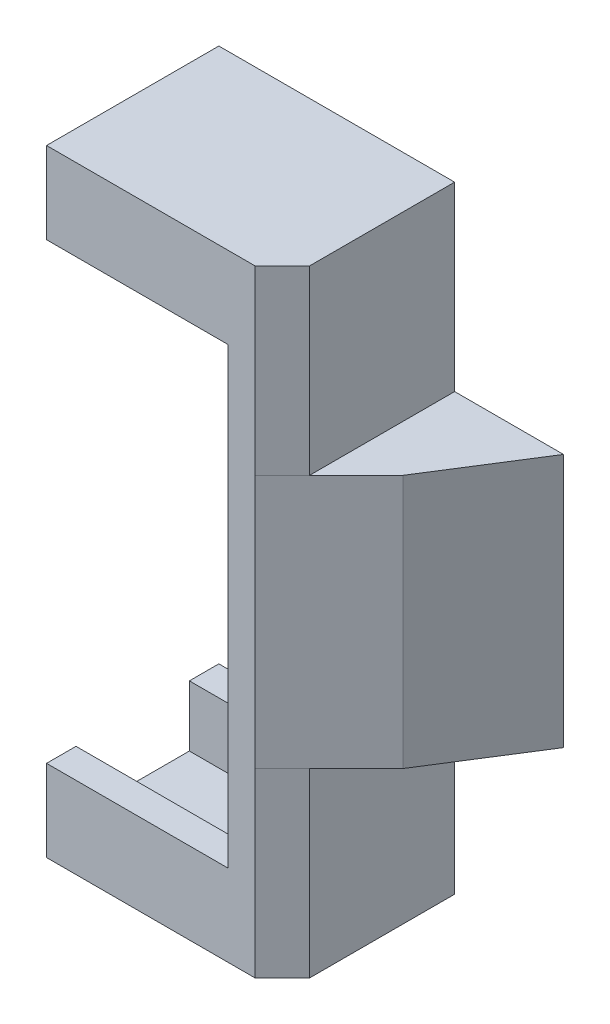
from build123d import *

# Parameters (mm, degrees)
BOSS_EXTRUDE1_DEPTH = 34
SKETCH2_W           = 6.25
SKETCH2_H           = 31.7
CUT_EXTRUDE1_DEPTH  = 12
SKETCH3_W           = 10
SKETCH3_H           = 25
CUT_EXTRUDE2_DEPTH  = 12
SKETCH4_W           = 6
SKETCH4_H           = 10
CUT_EXTRUDE3_DEPTH  = 10
CHAMFER2_SIZE       = 1.5
CHAMFER3_SIZE       = 1.5
CHAMFER4_SIZE       = 1.5
CHAMFER4_SIZE_2     = 4.815472512


with BuildPart() as part:
    # Sketch1 → Boss-Extrude1 (new body)
    with BuildSketch(Plane(origin=(0, 0, 0), x_dir=(1, 0, 0), z_dir=(0, 1, 0))):
        Polygon((6.5, 4.75), (12.5, 4.75), (6.5, -4.75), (-6.5, -4.75), (-6.5, 4.75), align=None)
    extrude(amount=BOSS_EXTRUDE1_DEPTH)

    # Sketch2 → Cut-Extrude1 (cut)
    with BuildSketch(Plane.ZY.offset(6.5)):
        with Locations((0, 17)):
            Rectangle(SKETCH2_W, SKETCH2_H)
    extrude(amount=-CUT_EXTRUDE1_DEPTH, mode=Mode.SUBTRACT)

    # Sketch3 → Cut-Extrude2 (cut)
    with BuildSketch(Plane.XY.offset(4.75)):
        with Locations((-1.5, 17)):
            Rectangle(SKETCH3_W, SKETCH3_H)
    extrude(amount=-CUT_EXTRUDE2_DEPTH, mode=Mode.SUBTRACT)

    # Sketch4 → Cut-Extrude3 (cut)
    with BuildSketch(Plane.XY.offset(4.75)):
        with Locations((9.5, 29)):
            Rectangle(SKETCH4_W, SKETCH4_H)
        with Locations((9.5, 5)):
            Rectangle(SKETCH4_W, SKETCH4_H)
    extrude(amount=-CUT_EXTRUDE3_DEPTH, mode=Mode.SUBTRACT)

    # Chamfer2
    chamfer2_edges = [part.edges().sort_by_distance(p)[0] for p in [
        (6.5, 29, 4.75),
    ]]
    chamfer(chamfer2_edges, length=CHAMFER2_SIZE)

    # Chamfer3
    chamfer3_edges = [part.edges().sort_by_distance(p)[0] for p in [
        (6.5, 5, 4.75),
    ]]
    chamfer(chamfer3_edges, length=CHAMFER3_SIZE)

    # Chamfer4
    # the kernel refuses this chamfer: 4.815472512, 1.5 mm, written as the material it takes off along each edge
    with BuildSketch(Plane(origin=(6.5, -2.508851902, 4.75), x_dir=(-0.9965532165776719, 0, 0.08295593124482357), z_dir=(0, 1, 0))) as chamfer4_piece_1:
        Polygon((CHAMFER4_SIZE * 0.996553216578, -CHAMFER4_SIZE * 0.0829559312448), (-CHAMFER4_SIZE_2 * 0.602290752459, -CHAMFER4_SIZE_2 * 0.798276799955), (0, 0), align=None)
    extrude(amount=39.017703804, mode=Mode.SUBTRACT)


solid = part.part
